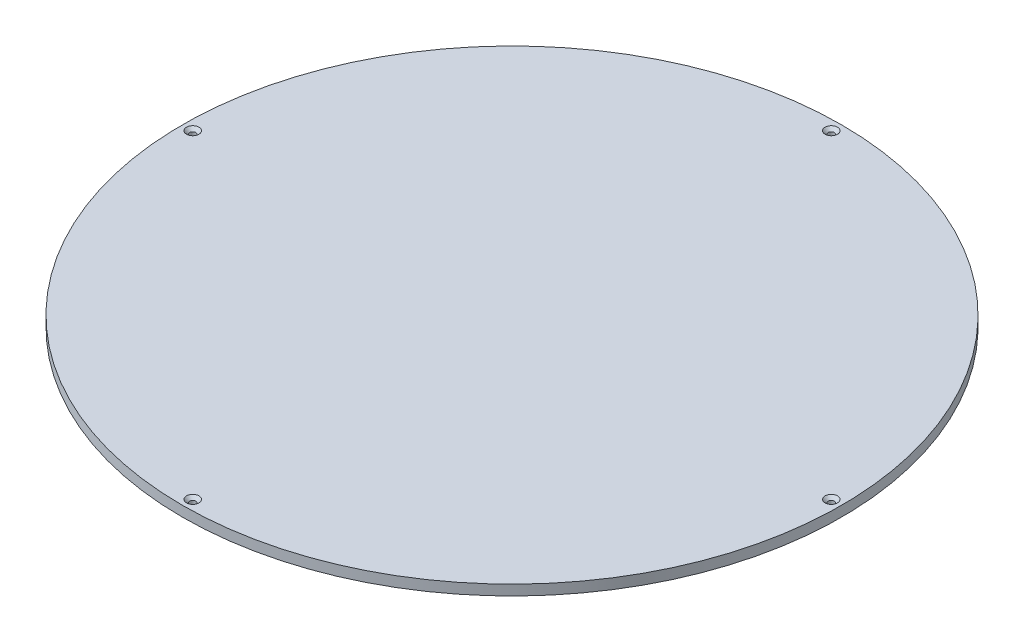
from build123d import *

# Parameters (mm, degrees)
SKETCH1_R           = 160
SKETCH1_R_2         = 1.5
BOSS_EXTRUDE1_DEPTH = 5
CHAMFER1_SIZE       = 1.5


with BuildPart() as part:
    # Sketch1 → Boss-Extrude1 (new body)
    with BuildSketch(Plane(origin=(0, 0, 0), x_dir=(1, 0, 0), z_dir=(0, 1, 0))):
        Circle(SKETCH1_R)
        with Locations((155, 0)):
            Circle(SKETCH1_R_2, mode=Mode.SUBTRACT)
        with Locations((0, -155)):
            Circle(SKETCH1_R_2, mode=Mode.SUBTRACT)
        with Locations((-155, 0)):
            Circle(SKETCH1_R_2, mode=Mode.SUBTRACT)
        with Locations((0, 155)):
            Circle(SKETCH1_R_2, mode=Mode.SUBTRACT)
    extrude(amount=-BOSS_EXTRUDE1_DEPTH)

    # Chamfer1
    chamfer1_edges = [part.edges().sort_by_distance(p)[0] for p in [
        (153.5, 0, 0),
        (-156.5, 0, 0),
        (-1.5, 0, -155),
        (-1.5, 0, 155),
    ]]
    chamfer(chamfer1_edges, length=CHAMFER1_SIZE)


solid = part.part
